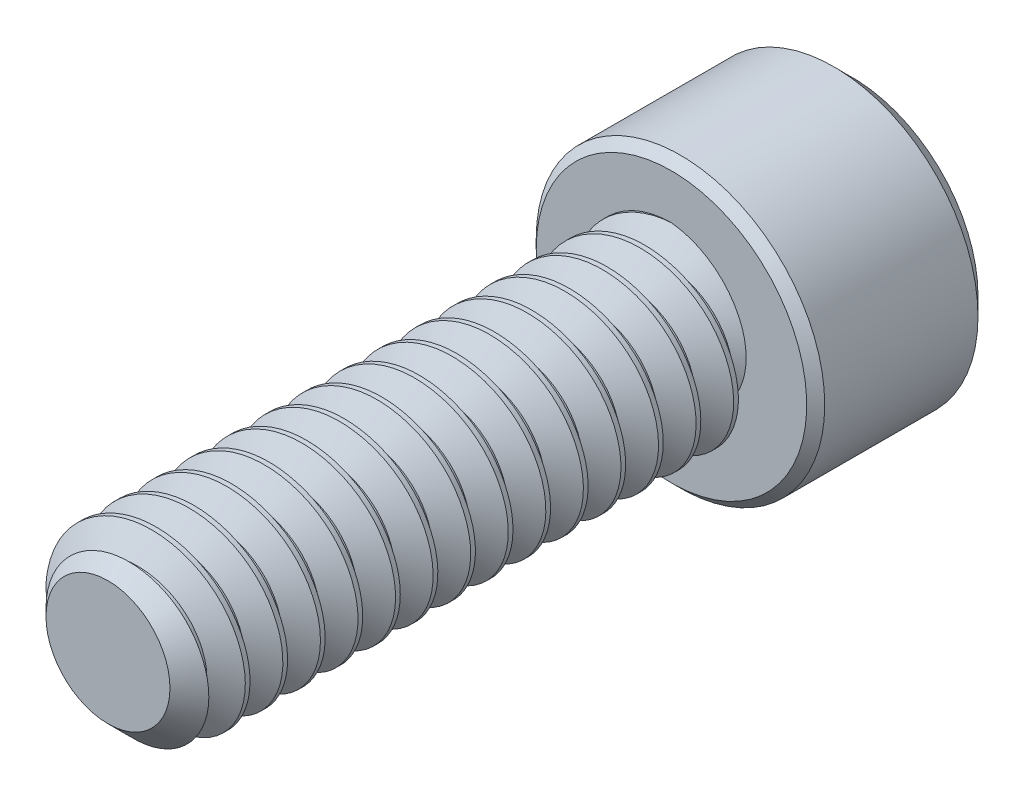
from build123d import *

# Parameters (mm, degrees)
SKETCH1_R          = 0.762
EXTRUDE1_DEPTH     = 4.7625
CHAMFER3_SIZE      = 0.238125
CUT_SWEEP1_PITCH   = 0.3175
SKETCH6_R          = 1.2192
EXTRUDE2_DEPTH     = 1.524
CUT_EXTRUDE1_DEPTH = 0.9525
SKETCH8_R          = 0.733234842
CUT_EXTRUDE2_DEPTH = 0.1524
CUT_EXTRUDE2_DRAFT = -45
CHAMFER1_SIZE      = 0.1524
CHAMFER2_SIZE      = 0.0762


with BuildPart() as part:
    # Sketch1 → Extrude1 (new body)
    with BuildSketch(Plane.XY):
        Circle(SKETCH1_R)
    extrude(amount=-EXTRUDE1_DEPTH)

    # Chamfer3
    chamfer3_edges = [part.edges().sort_by_distance(p)[0] for p in [
        (-0.762, 0, 0),
    ]]
    chamfer(chamfer3_edges, length=CHAMFER3_SIZE)

    # Cut-Sweep1: the profile of Sketch3 profile screwed along a right-hand helix of 16 turns, 6 arcs to a turn; built about Z, then put on its axis
    cut_sweep1_z = Axis((0, 0, 0), (0, 0, 1))
    cut_sweep1_corners = [(0.7623, 0, -0.277985705), (0.555777701, 0, -0.15875), (0.555777701, 0, -0.1190625), (0.7623, 0, 0.000173205)]
    with BuildLine(mode=Mode.PRIVATE) as cut_sweep1_profile:
        Line(cut_sweep1_corners[0], cut_sweep1_corners[1])
        Line(cut_sweep1_corners[1], cut_sweep1_corners[2])
        Line(cut_sweep1_corners[2], cut_sweep1_corners[3])
        Line(cut_sweep1_corners[3], cut_sweep1_corners[0])
    cut_sweep1_cap = Face(cut_sweep1_profile.wire())
    cut_sweep1_turn_angles = [0, 30, 60, 90, 120, 150, 180, 210, 240, 270, 300, 330, 360]
    cut_sweep1_turn_weights = [1, 0.8660254037844387, 1, 0.8660254037844387, 1, 0.8660254037844387, 1, 0.8660254037844387, 1, 0.8660254037844387, 1, 0.8660254037844387, 1]
    cut_sweep1_turn_rails = [Edge.make_bspline([Vector(p[0], p[1], 0).rotate(cut_sweep1_z, cut_sweep1_turn_angles[k]) / cut_sweep1_turn_weights[k] + Vector(0, 0, p[2] + CUT_SWEEP1_PITCH * cut_sweep1_turn_angles[k] / 360) for k in range(13)], [0, 0, 0, 1, 1, 2, 2, 3, 3, 4, 4, 5, 5, 6, 6, 6], 2, cut_sweep1_turn_weights) for p in cut_sweep1_corners]
    cut_sweep1_turn_sides = [Face.make_surface_from_curves(cut_sweep1_turn_rails[p[0]], cut_sweep1_turn_rails[p[1]]) for p in [(0, 1), (1, 2), (2, 3), (3, 0)]]
    cut_sweep1 = Plane(origin=(0, 0, 0), x_dir=(0, 1, 0), z_dir=(0, 0, -1)) * Solid(Shell([*[p.moved(Location((0, 0, CUT_SWEEP1_PITCH * i))) for i in range(16) for p in cut_sweep1_turn_sides], cut_sweep1_cap, cut_sweep1_cap.rotate(cut_sweep1_z, 5760).moved(Location((0, 0, CUT_SWEEP1_PITCH * 5760 / 360)))]))
    add(cut_sweep1, mode=Mode.SUBTRACT)

    # Sketch6 → Extrude2 (add)
    with BuildSketch(Plane(origin=(0, 0, -4.7625), x_dir=(-1, 0, 0), z_dir=(0, 0, -1))):
        with Locations(Location((0, 0, 0), (0, 0, 180))):
            Circle(SKETCH6_R)
    extrude(amount=EXTRUDE2_DEPTH)

    # Sketch7 → Cut-Extrude1 (cut)
    with BuildSketch(Plane(origin=(0, 0, -6.2865), x_dir=(-1, 0, 0), z_dir=(0, 0, -1))):
        Polygon((0, 0.733234842), (-0.635, 0.366617421), (-0.635, -0.366617421), (0, -0.733234842), (0.635, -0.366617421), (0.635, 0.366617421), align=None)
    extrude(amount=-CUT_EXTRUDE1_DEPTH, mode=Mode.SUBTRACT)


with BuildPart() as cut_extrude2_tool:
    # Sketch8 → Cut-Extrude2 (with draft: the straight prism first)
    with BuildSketch(Plane(origin=(0, 0, -6.2865), x_dir=(-1, 0, 0), z_dir=(0, 0, -1))):
        Circle(SKETCH8_R)
    extrude(amount=-CUT_EXTRUDE2_DEPTH)
    # Cut-Extrude2: the draft: its side faces are tilted about the plane it starts from
    cut_extrude2_sides = [cut_extrude2_tool.faces().sort_by_distance(p)[0] for p in [
        (0.733234842, 0, -6.2103),
    ]]
    draft(cut_extrude2_sides, Plane(origin=(0, 0, -6.2865), x_dir=(-1, 0, 0), z_dir=(0, 0, -1)), CUT_EXTRUDE2_DRAFT)


with BuildPart() as part_1:
    add(part.part)

    # Cut-Extrude2: cut by cut_extrude2_tool
    add(cut_extrude2_tool.part, mode=Mode.SUBTRACT)

    # Chamfer1
    chamfer1_edges = [part_1.edges().sort_by_distance(p)[0] for p in [
        (-1.2192, 0, -6.2865),
    ]]
    chamfer(chamfer1_edges, length=CHAMFER1_SIZE)

    # Chamfer2
    chamfer2_edges = [part_1.edges().sort_by_distance(p)[0] for p in [
        (-1.2192, 0, -4.7625),
    ]]
    chamfer(chamfer2_edges, length=CHAMFER2_SIZE)


solid = part_1.part
